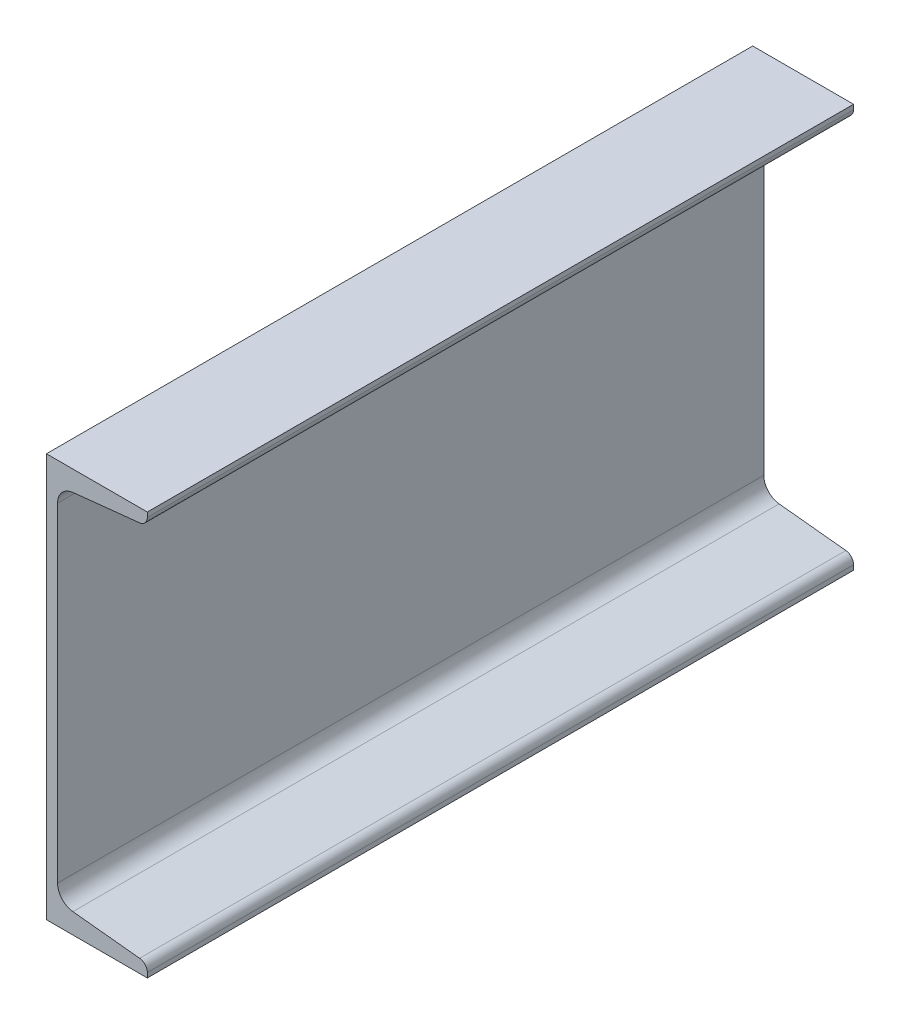
from build123d import *

# Parameters (mm, degrees)
BASEMCHANNEL_START = -350
BASEMCHANNEL_DEPTH = 700
TOEFILLET_R        = 8.5


# Read off the part's stored shape, not the designer's step: BaseMchannel
with BuildPart() as part:
    # BaseMchannel outline → BaseMchannel (new body)
    with BuildSketch(Plane.XY.offset(BASEMCHANNEL_START)):
        with BuildLine():
            Line((0, 400), (0, 0))
            Line((0, 0), (100, 0))
            Line((100, 0), (100, 12.322861527))
            Line((100, 12.322861527), (26.223016124, 20.077134998))
            ThreePointArc((26.223016124, 20.077134998), (15.366537967, 25.608786911), (11, 36.984007219))
            Line((11, 36.984007219), (11, 363.015992781))
            ThreePointArc((11, 363.015992781), (15.366537967, 374.391213089), (26.223016124, 379.922865002))
            Line((26.223016124, 379.922865002), (100, 387.677138473))
            Line((100, 387.677138473), (100, 400))
            Line((100, 400), (0, 400))
        make_face()
    extrude(amount=BASEMCHANNEL_DEPTH)

    # ToeFillet
    toefillet_edges = [part.edges().sort_by_distance(p)[0] for p in [
        (100, 387.677138473, 0),
        (100, 12.322861527, 0),
    ]]
    fillet(toefillet_edges, radius=TOEFILLET_R)


solid = part.part
